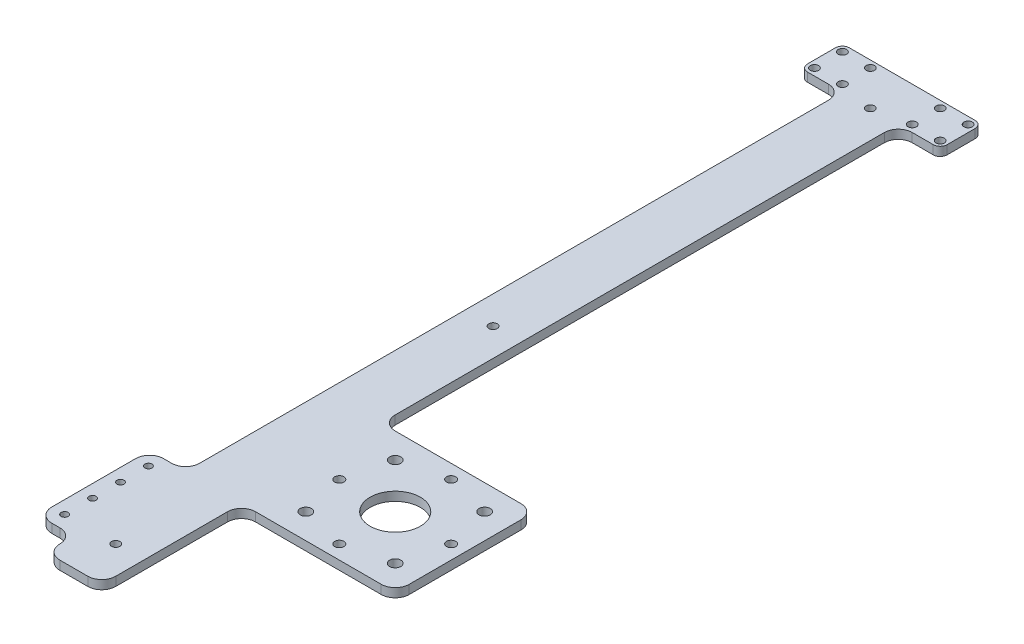
from build123d import *

# Parameters (mm, degrees)
SKETCH1_R           = 1.25
SKETCH1_R_2         = 2
SKETCH1_R_3         = 9
BOSS_EXTRUDE1_DEPTH = 3.175
SKETCH2_R           = 1.65
CUT_EXTRUDE1_DEPTH  = 164.508656116
SKETCH3_R           = 1.5
CUT_EXTRUDE2_DEPTH  = 164.508656116
SKETCH4_W           = 15
SKETCH4_H           = 15
SKETCH4_R           = 1.5
BOSS_EXTRUDE2_DEPTH = 3.175
FILLET1_DEPTH       = 3.175
FILLET1_2_DEPTH     = 3.175
FILLET2_R           = 2.5


with BuildPart() as part:
    # Sketch1 → Boss-Extrude1 (new body)
    with BuildSketch(Plane(origin=(0, 0, 0), x_dir=(1, 0, 0), z_dir=(0, 1, 0))):
        Polygon((65, -50), (10, -50), (10, 150), (-10, 150), (-10, -100), (-22.9, -100), (-22.9, -140), (-10, -140), (-10, -150), (0, -150), (10, -150), (10, -100), (65, -100), align=None)
        with Locations(Location((-18.3, -135, 0), (0, 0, 270))):
            Circle(SKETCH1_R, mode=Mode.SUBTRACT)
        with Locations(Location((-18.3, -125, 0), (0, 0, 270))):
            Circle(SKETCH1_R, mode=Mode.SUBTRACT)
        with Locations(Location((-18.3, -115, 0), (0, 0, 270))):
            Circle(SKETCH1_R, mode=Mode.SUBTRACT)
        with Locations(Location((-18.3, -105, 0), (0, 0, 270))):
            Circle(SKETCH1_R, mode=Mode.SUBTRACT)
        with Locations(Location((24, -59, 0), (0, 0, 270))):
            Circle(SKETCH1_R_2, mode=Mode.SUBTRACT)
        with Locations(Location((56, -59, 0), (0, 0, 270))):
            Circle(SKETCH1_R_2, mode=Mode.SUBTRACT)
        with Locations(Location((24, -91, 0), (0, 0, 270))):
            Circle(SKETCH1_R_2, mode=Mode.SUBTRACT)
        with Locations(Location((56, -91, 0), (0, 0, 270))):
            Circle(SKETCH1_R_2, mode=Mode.SUBTRACT)
        with Locations(Location((40, -75, 0), (0, 0, 270))):
            Circle(SKETCH1_R_3, mode=Mode.SUBTRACT)
    extrude(amount=BOSS_EXTRUDE1_DEPTH)

    # Sketch2 → Cut-Extrude1 (cut, through all)
    with BuildSketch(Plane(origin=(0, 3.175, 0), x_dir=(1, 0, 0), z_dir=(0, 1, 0))):
        with Locations(Location((40, -55, 0), (0, 0, 270))):
            Circle(SKETCH2_R)
        with Locations(Location((60, -75, 0), (0, 0, 270))):
            Circle(SKETCH2_R)
        with Locations(Location((40, -95, 0), (0, 0, 270))):
            Circle(SKETCH2_R)
        with Locations(Location((20, -75, 0), (0, 0, 270))):
            Circle(SKETCH2_R)
    extrude(amount=-CUT_EXTRUDE1_DEPTH, mode=Mode.SUBTRACT)

    # Sketch3 → Cut-Extrude2 (cut, through all)
    with BuildSketch(Plane(origin=(0, 3.175, 0), x_dir=(1, 0, 0), z_dir=(0, 1, 0))):
        with Locations(Location((0, 0, 0), (0, 0, 270))):
            Circle(SKETCH3_R)
        with Locations(Location((0, -135, 0), (0, 0, 270))):
            Circle(SKETCH3_R)
        with Locations(Location((0, 135, 0), (0, 0, 270))):
            Circle(SKETCH3_R)
    extrude(amount=-CUT_EXTRUDE2_DEPTH, mode=Mode.SUBTRACT)

    # Sketch4 → Boss-Extrude2 (add)
    # profile 1 of 5: a face of its own
    with BuildSketch(Plane(origin=(0, 3.175, 0), x_dir=(1, 0, 0), z_dir=(0, 1, 0))):
        with Locations((-17.5, 142.5)):
            Rectangle(SKETCH4_W, SKETCH4_H)
        with Locations(Location((-22.5, 137.5, 0), (0, 0, 270))):
            Circle(SKETCH4_R, mode=Mode.SUBTRACT)
        with Locations(Location((-12.5, 137.5, 0), (0, 0, 270))):
            Circle(SKETCH4_R, mode=Mode.SUBTRACT)
        with Locations(Location((-22.5, 147.5, 0), (0, 0, 270))):
            Circle(SKETCH4_R, mode=Mode.SUBTRACT)
        with Locations(Location((-12.5, 147.5, 0), (0, 0, 270))):
            Circle(SKETCH4_R, mode=Mode.SUBTRACT)
    # profile 2 of 5: a face of its own
    with BuildSketch(Plane(origin=(0, 3.175, 0), x_dir=(1, 0, 0), z_dir=(0, 1, 0))):
        with BuildLine():
            Line((17.5, 150), (10, 150))
            Line((10, 150), (10, 135))
            Line((10, 135), (17.5, 135))
            Line((17.5, 135), (17.5, 137.5))
            Line((17.5, 137.5), (14, 137.5))
            ThreePointArc((14, 137.5), (11.439339828, 136.439339828), (12.5, 139))
            Line((12.5, 139), (12.5, 146))
            ThreePointArc((12.5, 146), (11.439339828, 148.560660172), (14, 147.5))
            Line((14, 147.5), (17.5, 147.5))
            Line((17.5, 147.5), (17.5, 150))
        make_face()
    # profile 3 of 5: a face of its own
    with BuildSketch(Plane(origin=(0, 3.175, 0), x_dir=(1, 0, 0), z_dir=(0, 1, 0))):
        with BuildLine():
            Line((25, 150), (17.5, 150))
            Line((17.5, 150), (17.5, 147.5))
            Line((17.5, 147.5), (21, 147.5))
            ThreePointArc((21, 147.5), (22.5, 149), (24, 147.5))
            ThreePointArc((24, 147.5), (23.560660172, 146.439339828), (22.5, 146))
            Line((22.5, 146), (22.5, 139))
            ThreePointArc((22.5, 139), (23.560660172, 138.560660172), (24, 137.5))
            ThreePointArc((24, 137.5), (22.5, 136), (21, 137.5))
            Line((21, 137.5), (17.5, 137.5))
            Line((17.5, 137.5), (17.5, 135))
            Line((17.5, 135), (25, 135))
            Line((25, 135), (25, 150))
        make_face()
    # profile 4 of 5: a face of its own
    with BuildSketch(Plane(origin=(0, 3.175, 0), x_dir=(1, 0, 0), z_dir=(0, 1, 0))):
        with BuildLine():
            Line((21, 147.5), (17.5, 147.5))
            Line((17.5, 147.5), (17.5, 137.5))
            Line((17.5, 137.5), (21, 137.5))
            ThreePointArc((21, 137.5), (21.439339828, 138.560660172), (22.5, 139))
            Line((22.5, 139), (22.5, 146))
            ThreePointArc((22.5, 146), (21.439339828, 146.439339828), (21, 147.5))
        make_face()
    # profile 5 of 5: a face of its own
    with BuildSketch(Plane(origin=(0, 3.175, 0), x_dir=(1, 0, 0), z_dir=(0, 1, 0))):
        with BuildLine():
            Line((17.5, 137.5), (17.5, 147.5))
            Line((17.5, 147.5), (14, 147.5))
            ThreePointArc((14, 147.5), (13.560660172, 146.439339828), (12.5, 146))
            Line((12.5, 146), (12.5, 139))
            ThreePointArc((12.5, 139), (13.560660172, 138.560660172), (14, 137.5))
            Line((14, 137.5), (17.5, 137.5))
        make_face()
    extrude(amount=-BOSS_EXTRUDE2_DEPTH)

    # Fillet1: read off the stored shape, not the designer's step
    # Fillet1 outline → Fillet1 (cut)
    with BuildSketch(Plane(origin=(0, 0, 0), x_dir=(1, 0, 0), z_dir=(0, 1, 0))):
        with BuildLine():
            ThreePointArc((60, -50), (63.535533906, -51.464466094), (65, -55))
            Line((65, -55), (65, -50))
            Line((65, -50), (60, -50))
        make_face()
        with BuildLine():
            ThreePointArc((65, -95), (63.535533906, -98.535533906), (60, -100))
            Line((60, -100), (65, -100))
            Line((65, -100), (65, -95))
        make_face()
        with BuildLine():
            ThreePointArc((10, -145), (8.535533906, -148.535533906), (5, -150))
            Line((5, -150), (10, -150))
            Line((10, -150), (10, -145))
        make_face()
        with BuildLine():
            ThreePointArc((-5, -150), (-8.535533906, -148.535533906), (-10, -145))
            Line((-10, -145), (-10, -150))
            Line((-10, -150), (-5, -150))
        make_face()
        with BuildLine():
            ThreePointArc((-17.9, -140), (-21.435533906, -138.535533906), (-22.9, -135))
            Line((-22.9, -135), (-22.9, -140))
            Line((-22.9, -140), (-17.9, -140))
        make_face()
        with BuildLine():
            ThreePointArc((-22.9, -105), (-21.435533906, -101.464466094), (-17.9, -100))
            Line((-17.9, -100), (-22.9, -100))
            Line((-22.9, -100), (-22.9, -105))
        make_face()
    extrude(amount=FILLET1_DEPTH, mode=Mode.SUBTRACT)

    # Fillet1 2 outline → Fillet1 2 (add)
    with BuildSketch(Plane(origin=(0, 0, 0), x_dir=(1, 0, 0), z_dir=(0, 1, 0))):
        with BuildLine():
            Line((10, 135), (10, 130))
            ThreePointArc((10, 130), (11.464466094, 133.535533906), (15, 135))
            Line((15, 135), (10, 135))
        make_face()
        with BuildLine():
            Line((10, -50), (15, -50))
            ThreePointArc((15, -50), (11.464466094, -48.535533906), (10, -45))
            Line((10, -45), (10, -50))
        make_face()
        with BuildLine():
            Line((10, -100), (10, -105))
            ThreePointArc((10, -105), (11.464466094, -101.464466094), (15, -100))
            Line((15, -100), (10, -100))
        make_face()
        with BuildLine():
            Line((-10, -140), (-15, -140))
            ThreePointArc((-15, -140), (-11.464466094, -141.464466094), (-10, -145))
            Line((-10, -145), (-10, -140))
        make_face()
        with BuildLine():
            ThreePointArc((-15, 135), (-11.464466094, 133.535533906), (-10, 130))
            Line((-10, 130), (-10, 135))
            Line((-10, 135), (-15, 135))
        make_face()
        with BuildLine():
            ThreePointArc((-10, -95), (-11.464466094, -98.535533906), (-15, -100))
            Line((-15, -100), (-10, -100))
            Line((-10, -100), (-10, -95))
        make_face()
    extrude(amount=FILLET1_2_DEPTH)

    # Fillet2
    fillet2_edges = [part.edges().sort_by_distance(p)[0] for p in [
        (-25, 1.5875, -135),
        (-25, 1.5875, -150),
        (25, 1.5875, -150),
        (25, 1.5875, -135),
    ]]
    fillet(fillet2_edges, radius=FILLET2_R)


solid = part.part
